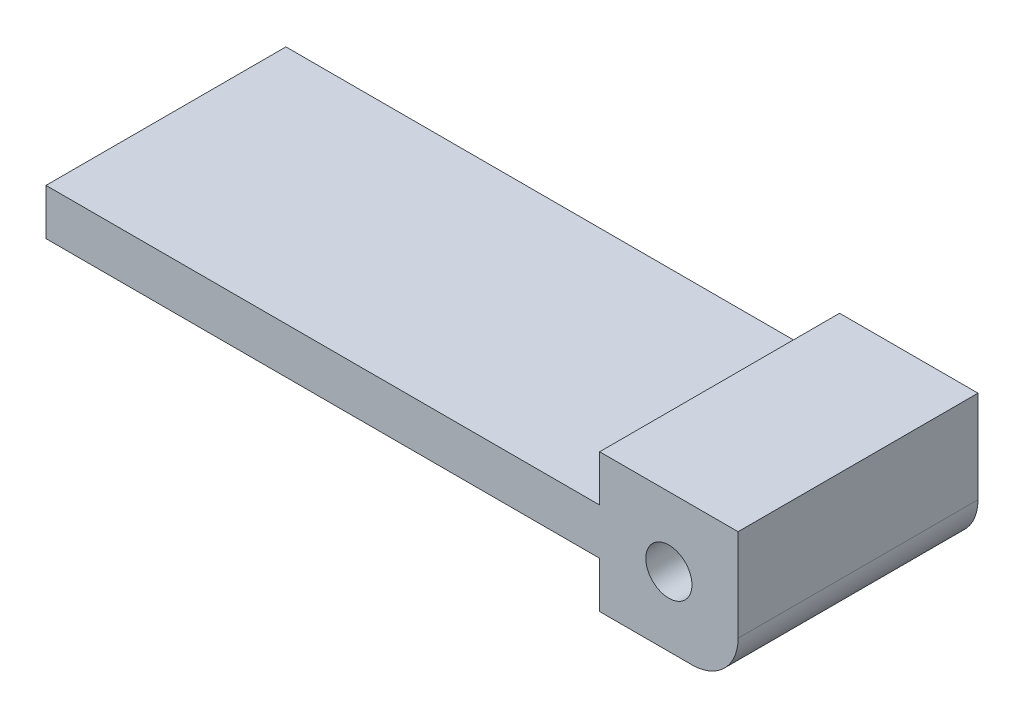
from build123d import *

# Parameters (mm, degrees)
AUFSATZ_LINEAR_AUSTRAGEN1_DEPTH = 26
SKIZZE2_R                       = 2.5
SCHNITT_LINEAR_AUSTRAGEN1_DEPTH = 81.783661714
VERRUNDUNG1_R                   = 5


with BuildPart() as part:
    # Skizze1 → Aufsatz-Linear austragen1 (new body)
    with BuildSketch(Plane.XY):
        Polygon((0, 0), (-15, 0), (-15, 5), (-75, 5), (-75, 10), (-15, 10), (-15, 15), (0, 15), align=None)
    extrude(amount=AUFSATZ_LINEAR_AUSTRAGEN1_DEPTH)

    # Skizze2 → Schnitt-Linear austragen1 (cut, through all)
    with BuildSketch(Plane.XY.offset(26)):
        with Locations((-7.5, 7.5)):
            Circle(SKIZZE2_R)
    extrude(amount=-SCHNITT_LINEAR_AUSTRAGEN1_DEPTH, mode=Mode.SUBTRACT)

    # Verrundung1
    verrundung1_edges = [part.edges().sort_by_distance(p)[0] for p in [
        (0, 0, 13),
    ]]
    fillet(verrundung1_edges, radius=VERRUNDUNG1_R)


solid = part.part
